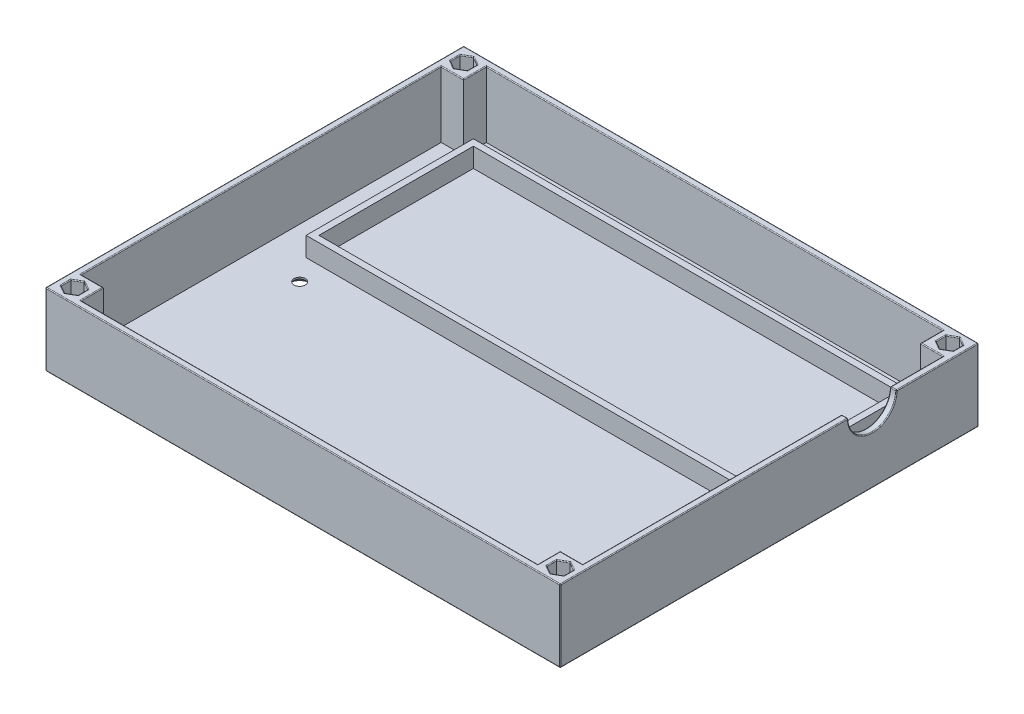
from build123d import *

# Parameters (mm, degrees)
SKETCH1_W           = 160
SKETCH1_H           = 130
SKETCH1_R           = 1.75
BOSS_EXTRUDE1_DEPTH = 2
BOSS_EXTRUDE3_START = 20.5
SKETCH1_4_W         = 160
SKETCH1_4_H         = 130
SKETCH1_4_R         = 1.75
BOSS_EXTRUDE3_DEPTH = 20.5
SKETCH1_6_W         = 136
SKETCH1_6_H         = 52
SKETCH1_6_W_2       = 132
SKETCH1_6_H_2       = 48
BOSS_EXTRUDE5_DEPTH = 6
SKETCH2_R           = 7.5
CUT_EXTRUDE1_DEPTH  = 2
CHAMFER1_SIZE       = 1.5
CUT_EXTRUDE2_DEPTH  = 5.25
FILLET1_R           = 0.25


with BuildPart() as part:
    # Sketch1 → Boss-Extrude1 (new body)
    with BuildSketch(Plane(origin=(0, 0, 0), x_dir=(1, 0, 0), z_dir=(0, 1, 0))):
        with Locations((0, -30)):
            Rectangle(SKETCH1_W, SKETCH1_H)
        with Locations((-75.5, 30.5)):
            Circle(SKETCH1_R, mode=Mode.SUBTRACT)
        with Locations((-62.5, -78.5)):
            Circle(SKETCH1_R, mode=Mode.SUBTRACT)
        with Locations((-62.5, -33.5)):
            Circle(SKETCH1_R, mode=Mode.SUBTRACT)
        with Locations((62.5, -78.5)):
            Circle(SKETCH1_R, mode=Mode.SUBTRACT)
        with Locations((62.5, -33.5)):
            Circle(SKETCH1_R, mode=Mode.SUBTRACT)
        with Locations((75.5, 30.5)):
            Circle(SKETCH1_R, mode=Mode.SUBTRACT)
        with Locations((75.5, -90.5)):
            Circle(SKETCH1_R, mode=Mode.SUBTRACT)
        with Locations((-75.5, -90.5)):
            Circle(SKETCH1_R, mode=Mode.SUBTRACT)
    extrude(amount=-BOSS_EXTRUDE1_DEPTH)

    # Sketch1<4> → Boss-Extrude3 (add)
    with BuildSketch(Plane(origin=(0, 0, 0), x_dir=(1, 0, 0), z_dir=(0, 1, 0)).offset(BOSS_EXTRUDE3_START)):
        with Locations((0, -30)):
            Rectangle(SKETCH1_4_W, SKETCH1_4_H)
        Polygon((-71, 26), (-71, 33), (71, 33), (71, 26), (78, 26), (78, -86), (71, -86), (71, -93), (-71, -93), (-71, -86), (-78, -86), (-78, 26), align=None, mode=Mode.SUBTRACT)
        with Locations((-75.5, 30.5)):
            Circle(SKETCH1_4_R, mode=Mode.SUBTRACT)
        with Locations((75.5, 30.5)):
            Circle(SKETCH1_4_R, mode=Mode.SUBTRACT)
        with Locations((-75.5, -90.5)):
            Circle(SKETCH1_4_R, mode=Mode.SUBTRACT)
        with Locations((75.5, -90.5)):
            Circle(SKETCH1_4_R, mode=Mode.SUBTRACT)
    extrude(amount=-BOSS_EXTRUDE3_DEPTH)

    # Sketch1<6> → Boss-Extrude5 (add)
    with BuildSketch(Plane(origin=(0, 0, 0), x_dir=(1, 0, 0), z_dir=(0, 1, 0))):
        Rectangle(SKETCH1_6_W, SKETCH1_6_H)
        Rectangle(SKETCH1_6_W_2, SKETCH1_6_H_2, mode=Mode.SUBTRACT)
    extrude(amount=BOSS_EXTRUDE5_DEPTH)

    # Sketch2 → Cut-Extrude1 (cut)
    with BuildSketch(Plane(origin=(80, 0, 0), x_dir=(0, 0, -1), z_dir=(1, 0, 0))):
        with Locations((2, 20.5)):
            Circle(SKETCH2_R)
    extrude(amount=-CUT_EXTRUDE1_DEPTH, mode=Mode.SUBTRACT)

    # Chamfer1
    chamfer1_edges = [part.edges().sort_by_distance(p)[0] for p in [
        (-77.25, -2, -30.5),
        (-64.25, -2, 78.5),
        (-64.25, -2, 33.5),
        (-77.25, -2, 90.5),
        (73.75, -2, 90.5),
        (60.75, -2, 78.5),
        (60.75, -2, 33.5),
        (73.75, -2, -30.5),
    ]]
    chamfer(chamfer1_edges, length=CHAMFER1_SIZE)

    # Sketch4 → Cut-Extrude2 (cut)
    with BuildSketch(Plane(origin=(0, 20.5, 0), x_dir=(-1, 0, 0), z_dir=(0, -1, 0))):
        Polygon((75.5, -93.531088913), (78.125, -92.015544457), (78.125, -88.984455543), (75.5, -87.468911087), (72.875, -88.984455543), (72.875, -92.015544457), align=None)
        Polygon((-75.5, -87.468911087), (-78.125, -88.984455543), (-78.125, -92.015544457), (-75.5, -93.531088913), (-72.875, -92.015544457), (-72.875, -88.984455543), align=None)
        Polygon((-75.5, 27.468911087), (-72.875, 28.984455543), (-72.875, 32.015544457), (-75.5, 33.531088913), (-78.125, 32.015544457), (-78.125, 28.984455543), align=None)
        Polygon((75.5, 33.531088913), (72.875, 32.015544457), (72.875, 28.984455543), (75.5, 27.468911087), (78.125, 28.984455543), (78.125, 32.015544457), align=None)
    extrude(amount=CUT_EXTRUDE2_DEPTH, mode=Mode.SUBTRACT)

    # Fillet1
    fillet1_edges = [part.edges().sort_by_distance(p)[0] for p in [
        (-80, -2, 30),
        (0, -2, 95),
        (80, -2, 30),
        (0, -2, -35),
        (78, 13, -2),
        (80, 13, -2),
        (80, 20.5, 50.25),
        (0, 20.5, 95),
        (-80, 20.5, 30),
        (0, 20.5, -35),
        (80, 20.5, -22.25),
        (79, 20.5, -9.5),
        (78, 20.5, -17.75),
        (74.5, 20.5, -26),
        (71, 20.5, -29.5),
        (0, 20.5, -33),
        (-71, 20.5, -29.5),
        (-78, 20.5, 30),
        (-74.5, 20.5, 86),
        (-71, 20.5, 89.5),
        (0, 20.5, 93),
        (71, 20.5, 89.5),
        (74.5, 20.5, 86),
        (78, 20.5, 45.75),
        (79, 20.5, 5.5),
        (80, 9.25, 95),
        (80, 9.25, -35),
        (-80, 9.25, -35),
        (-80, 9.25, 95),
        (72.25, -2, -30.5),
        (59.25, -2, 33.5),
        (59.25, -2, 78.5),
        (72.25, -2, 90.5),
        (-78.75, -2, 90.5),
        (-65.75, -2, 33.5),
        (-65.75, -2, 78.5),
        (-78.75, -2, -30.5),
        (-76.8125, 20.5, -28.226683315),
        (-74.1875, 20.5, -28.226683315),
        (-72.875, 20.5, -30.5),
        (-74.1875, 20.5, -32.773316685),
        (-76.8125, 20.5, -32.773316685),
        (-78.125, 20.5, -30.5),
        (74.1875, 20.5, 92.773316685),
        (76.8125, 20.5, 92.773316685),
        (78.125, 20.5, 90.5),
        (76.8125, 20.5, 88.226683315),
        (74.1875, 20.5, 88.226683315),
        (72.875, 20.5, 90.5),
        (-74.1875, 20.5, 88.226683315),
        (-76.8125, 20.5, 88.226683315),
        (-78.125, 20.5, 90.5),
        (-76.8125, 20.5, 92.773316685),
        (-74.1875, 20.5, 92.773316685),
        (-72.875, 20.5, 90.5),
        (76.8125, 20.5, -32.773316685),
        (74.1875, 20.5, -32.773316685),
        (72.875, 20.5, -30.5),
        (74.1875, 20.5, -28.226683315),
        (76.8125, 20.5, -28.226683315),
        (78.125, 20.5, -30.5),
        (-74.5, 20.5, -26),
    ]]
    fillet(fillet1_edges, radius=FILLET1_R)


solid = part.part
